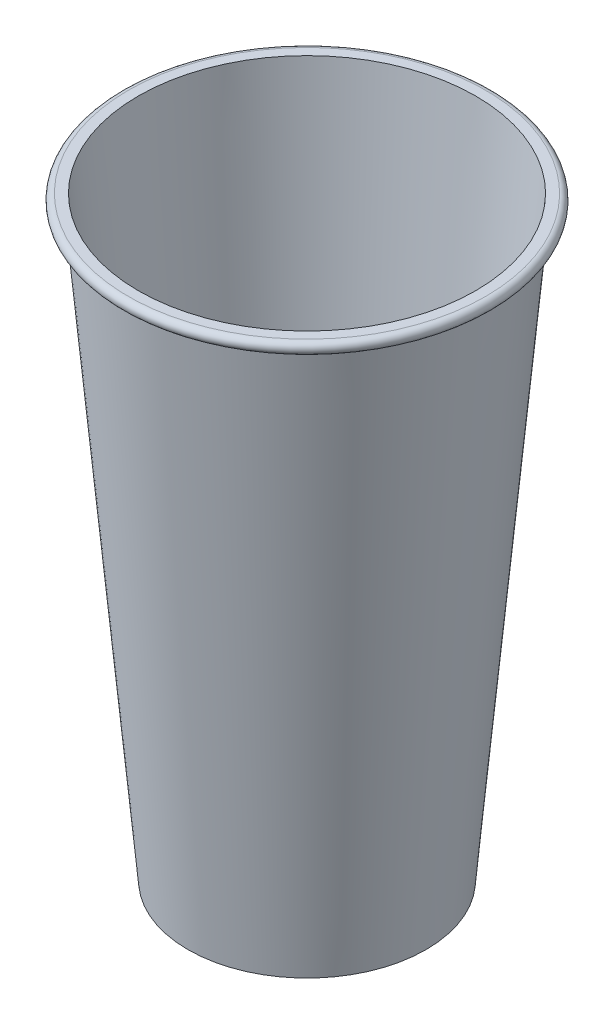
from build123d import *

# Parameters (mm, degrees)
SKETCH5_R           = 25
BOSS_EXTRUDE1_DEPTH = 1


# Read off the part's stored shape, not the designer's step: Loft-Thin1
with BuildPart() as part:
    # Loft-Thin1 outline → Loft-Thin1 (revolve)
    with BuildSketch(Plane.XY):
        Polygon((42.495958168, 150), (28.995958168, 0), (30, 0), (43.5, 150), align=None)
    revolve(axis=Axis((0, 0, 0), (0, 1, 0)))

    # Sketch6 → Revolve1 (revolve)
    with BuildSketch(Plane.XY, mode=Mode.PRIVATE) as revolve1_sk:
        with BuildLine():
            Line((43.5, 150), (43.23, 147))
            Line((43.23, 147), (45, 147))
            ThreePointArc((45, 147), (46.5, 148.5), (45, 150))
            Line((45, 150), (43.5, 150))
        make_face()
    revolve(revolve1_sk.sketch.rotate(Axis((0, 150, 0), (0, -1, 0)), 90), axis=Axis((0, 150, 0), (0, -1, 0)))


with BuildPart() as body_2:
    # Sketch5 → Boss-Extrude1 (new body)
    with BuildSketch(Plane.XZ):
        with Locations(Location((0, 0, 0), (0, 0, 270))):
            Circle(SKETCH5_R)
    extrude(amount=BOSS_EXTRUDE1_DEPTH)


solid = Compound([part.part, body_2.part])
